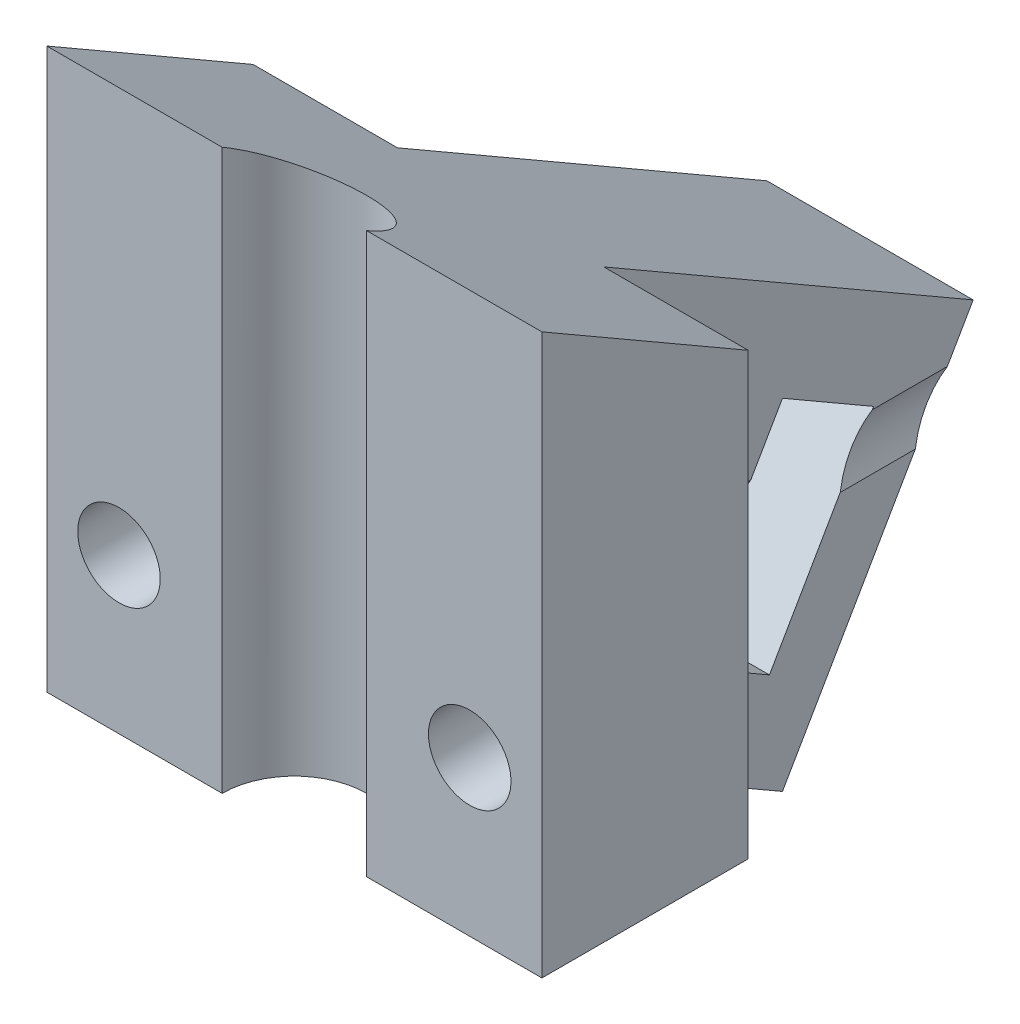
from build123d import *

# Parameters (mm, degrees)
SKETCH_1_W              = 48
SKETCH_1_H              = 20
EXTRUDE_1_DEPTH         = 30
SKETCH_2_W              = 14
SKETCH_2_H              = 30
CUT_EXTRUDE_1_DEPTH     = 7
EXTRUDE_2_DEPTH         = 48
CUT_EXTRUDE_2_DEPTH     = 14
CUT_EXTRUDE_3_DEPTH     = 14
CUT_EXTRUDE_4_DEPTH     = 65.456478054
SKETCH_13_R             = 4
CUT_EXTRUDE_5_DEPTH     = 53.52066051
SKETCH_14_R             = 4
CUT_EXTRUDE_6_DEPTH     = 53.52066051
FILLET_1_R              = 7
EXTRUDE_5_DEPTH         = 1
SKETCH_20_R             = 7.5
CUT_EXTRUDE_8_DEPTH     = 53.52066051
BOSS_EXTRUDE1_DEPTH     = 25
CUT_EXTRUDE1_DEPTH      = 80.244164221
CUT_EXTRUDE1_DEPTH_BACK = 80.244164221


with BuildPart() as part:
    # Эскиз1 → Бобышка-Вытянуть1 (new body)
    with BuildSketch(Plane(origin=(0, 0, 0), x_dir=(1, 0, 0), z_dir=(0, 1, 0))):
        Rectangle(SKETCH_1_W, SKETCH_1_H)
    extrude(amount=EXTRUDE_1_DEPTH)

    # Эскиз2 → Вырез-Вытянуть1 (cut)
    with BuildSketch(Plane.XY.offset(10)):
        with Locations((0, 15)):
            Rectangle(SKETCH_2_W, SKETCH_2_H)
    extrude(amount=-CUT_EXTRUDE_1_DEPTH, mode=Mode.SUBTRACT)

    # Эскиз7 → Бобышка-Вытянуть2 (add)
    with BuildSketch(Plane(origin=(24, 0, 0), x_dir=(0, 0, -1), z_dir=(1, 0, 0))):
        Polygon((10, 0), (27.320508076, -10), (45.810889132, 22.026279442), (32, 30), (10, 30), align=None)
    extrude(amount=-EXTRUDE_2_DEPTH)

    # Эскиз8 → Вырез-Вытянуть2 (cut)
    with BuildSketch(Plane(origin=(24, 0, 0), x_dir=(0, 0, -1), z_dir=(1, 0, 0))):
        Polygon((10, 0), (10, 30), (32, 30), (45.810889132, 22.026279442), (27.320508076, -10), align=None)
    extrude(amount=-CUT_EXTRUDE_2_DEPTH, mode=Mode.SUBTRACT)

    # Эскиз9 → Вырез-Вытянуть3 (cut)
    with BuildSketch(Plane.ZY.offset(24)):
        Polygon((-10, 0), (-10, 30), (-32, 30), (-45.810889132, 22.026279442), (-27.320508076, -10), align=None)
    extrude(amount=-CUT_EXTRUDE_3_DEPTH, mode=Mode.SUBTRACT)

    # Эскиз11 → Вырез-Вытянуть4 (cut, through all)
    with BuildSketch(Plane.ZY.offset(10)):
        Polygon((-17.221869062, 5.518829477), (-27.321869062, 23.012542633), (-36.15532818, 17.912542633), (-26.05532818, 0.418829477), align=None)
    extrude(amount=-CUT_EXTRUDE_4_DEPTH, mode=Mode.SUBTRACT)

    # Эскиз13 → Вырез-Вытянуть5 (cut, through all)
    with BuildSketch(Plane(origin=(0, 0, -10), x_dir=(-1, 0, 0), z_dir=(0, 0, -1))):
        with Locations((17, 15)):
            Circle(SKETCH_13_R)
    extrude(amount=-CUT_EXTRUDE_5_DEPTH, mode=Mode.SUBTRACT)

    # Эскиз14 → Вырез-Вытянуть6 (cut, through all)
    with BuildSketch(Plane(origin=(0, 0, -10), x_dir=(-1, 0, 0), z_dir=(0, 0, -1))):
        with Locations((-17, 15)):
            Circle(SKETCH_14_R)
    extrude(amount=-CUT_EXTRUDE_6_DEPTH, mode=Mode.SUBTRACT)

    # Скругление1
    fillet_1_edges = [part.edges().sort_by_distance(p)[0] for p in [
        (-7, 15, 3),
        (7, 15, 3),
    ]]
    fillet(fillet_1_edges, radius=FILLET_1_R - 0.0001)  # a hair under: the kernel refuses the full size

    # Эскиз18 → Бобышка-Вытянуть5 (add)
    with BuildSketch(Plane(origin=(0, -14.330127019, -24.820508076), x_dir=(-1, 0, 0), z_dir=(0, -0.49999999999998845, -0.8660254037844453))):
        Polygon((2.153846154, 23.490381057), (2.153846154, 15.490381057), (1.025641026, 15.490381057), (1.025641026, 22.567304134), (-2.769230769, 22.567304134), (-2.769230769, 23.490381057), align=None)
    extrude(amount=EXTRUDE_5_DEPTH)

    # Эскиз20 → Вырез-Вытянуть8 (cut, through all)
    with BuildSketch(Plane(origin=(0, 0, -10), x_dir=(-1, 0, 0), z_dir=(0, 0, -1))):
        with Locations((-17, 15)):
            Circle(SKETCH_20_R)
        with Locations((17, 15)):
            Circle(SKETCH_20_R)
    extrude(amount=CUT_EXTRUDE_8_DEPTH, mode=Mode.SUBTRACT)

    # Sketch3 → Boss-Extrude1 (add)
    with BuildSketch(Plane(origin=(0, 30, 0), x_dir=(1, 0, 0), z_dir=(0, 1, 0))):
        with BuildLine():
            Line((7, -10), (24, -10))
            Line((24, -10), (24, 10))
            Line((24, 10), (10, 10))
            Line((10, 10), (10, 32))
            Line((10, 32), (-10, 32))
            Line((-10, 32), (-10, 10))
            Line((-10, 10), (-24, 10))
            Line((-24, 10), (-24, -10))
            Line((-24, -10), (-7, -10))
            ThreePointArc((-7, -10), (0, -3), (7, -10))
        make_face()
    extrude(amount=BOSS_EXTRUDE1_DEPTH)

    # Sketch4 → Cut-Extrude1 (cut, two sides: drawn at the far end of the back side and taken through both)
    with BuildSketch(Plane.ZY.offset(10).offset(-CUT_EXTRUDE1_DEPTH_BACK)):
        Polygon((-251.050138341, -96.468656337), (-45.810889132, 22.026279442), (35.63071017, 69.046608722), (240.869959379, 187.541544501), (3.880087821, 598.020042918), (-488.040009899, 314.00984208), align=None)
    extrude(amount=CUT_EXTRUDE1_DEPTH + CUT_EXTRUDE1_DEPTH_BACK, mode=Mode.SUBTRACT)


solid = part.part
